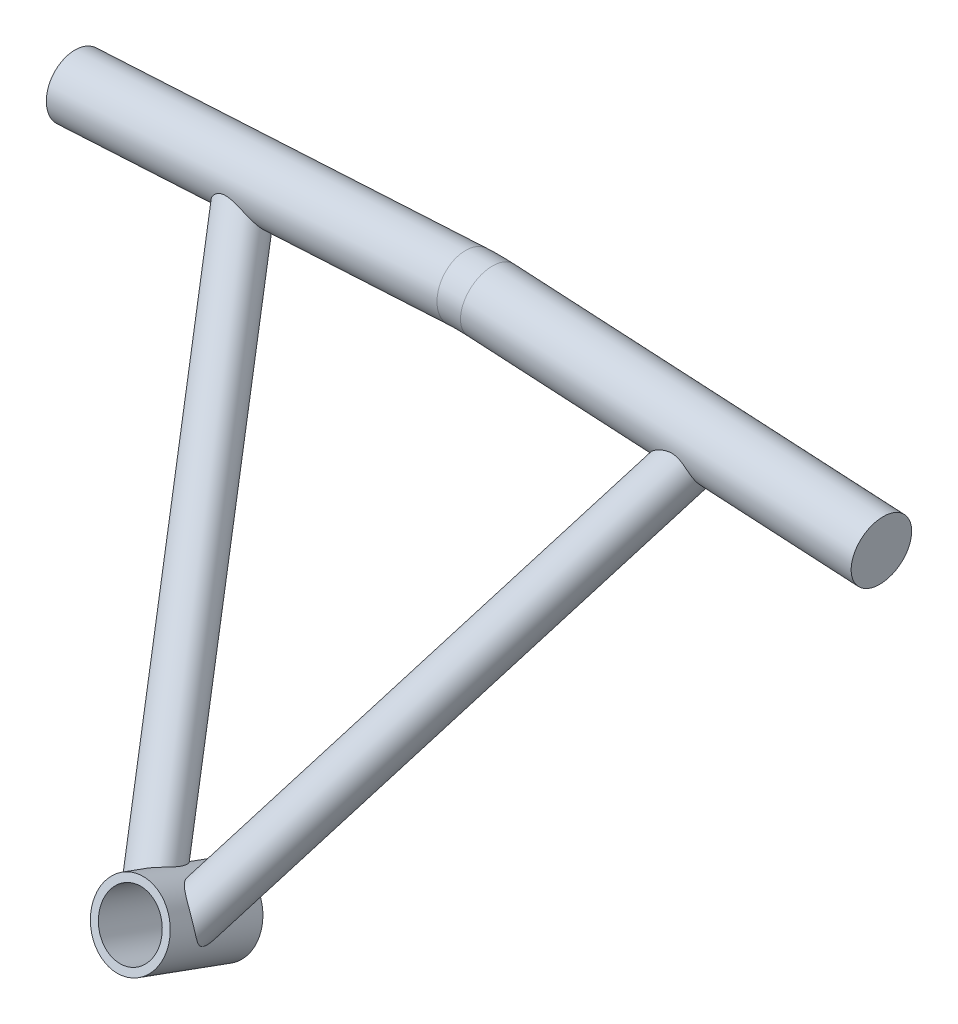
from build123d import *

# Parameters (mm, degrees)
SKETCH1_R           = 15.875
BOSS_EXTRUDE1_DEPTH = 20.701
SWEEP1_PROFILE_R    = 9.525
SWEEP2_PROFILE_R    = 9.525
CUT_EXTRUDE1_REACH  = 236.767
SKETCH2_R           = 12.7
SKETCH36_R          = 7.9375
CUT_EXTRUDE2_DEPTH  = 127
SKETCH37_R          = 7.9375
CUT_EXTRUDE3_DEPTH  = 127
SWEEP3_PROFILE_R    = 12.7


with BuildPart() as part:
    # Sketch1 → Boss-Extrude1 (new, symmetric)
    with BuildSketch(Plane(origin=(0, 0, 0), x_dir=(1, 0, 0), z_dir=(0, 0.34202014332566943, 0.9396926207859081))):
        Circle(SKETCH1_R)
    extrude(amount=BOSS_EXTRUDE1_DEPTH, both=True)

    # Sweep1: sweep along a path in Sketch4
    with BuildLine(Plane(origin=(0, 3.126764616, 3.726332964), x_dir=(1, 0, 0), z_dir=(0, 0.6427876096865406, 0.7660444431189771))) as sweep1_path:
        Line((-5.08, -4.081701322), (-98.059996607, 204.754790296))
    # Sweep1 profile (on start of the path) → Sweep1 (sweep)
    with BuildSketch(Plane(origin=(-5.08, 0, 6.35), x_dir=(0, 0.6427876096865405, 0.766044443118977), z_dir=(-0.4067366430758009, 0.699816421363697, -0.587215701058084))):
        Circle(SWEEP1_PROFILE_R)
    sweep(path=sweep1_path.line)

    # Sweep2: sweep along a path in Sketch15
    with BuildLine(Plane(origin=(0, 3.126764616, 3.726332964), x_dir=(1, 0, 0), z_dir=(0, 0.6427876096865406, 0.7660444431189771))) as sweep2_path:
        Line((5.08, -4.081701322), (98.059996607, 204.754790296))
    # Sweep2 profile (on start of the path) → Sweep2 (sweep)
    with BuildSketch(Plane(origin=(5.08, 0, 6.35), x_dir=(0, 0.6427876096865406, 0.766044443118977), z_dir=(0.40673664307580104, 0.6998164213636969, -0.587215701058084))):
        Circle(SWEEP2_PROFILE_R)
    sweep(path=sweep2_path.line)

    # Sketch2 → Cut-Extrude1 (cut, up to next)
    with BuildSketch(Plane(origin=(0, -7.080158987, -19.452576943), x_dir=(-1, 0, 0), z_dir=(0, -0.34202014332566943, -0.9396926207859081)), mode=Mode.PRIVATE) as cut_extrude1_sk1:
        Circle(SKETCH2_R)
    cut_extrude1_tool1 = extrude(cut_extrude1_sk1.sketch, amount=-CUT_EXTRUDE1_REACH, mode=Mode.PRIVATE) & part.part
    add(cut_extrude1_tool1.solids().sort_by_distance((0, -7.080159, -19.452577))[0], mode=Mode.SUBTRACT)

    # Sketch36 → Cut-Extrude2 (cut)
    with BuildSketch(Plane(origin=(-92.303757259, 158.814520853, -133.261205873), x_dir=(0.9135454576426006, 0.31157834524108413, -0.2614452745746218), z_dir=(-0.40673664307580104, 0.699816421363697, -0.5872157010580841))):
        with Locations((-6.300988418, -4.864382214)):
            Circle(SKETCH36_R)
    extrude(amount=-CUT_EXTRUDE2_DEPTH, mode=Mode.SUBTRACT)

    # Sketch37 → Cut-Extrude3 (cut)
    with BuildSketch(Plane(origin=(92.303757259, 158.814520853, -133.261205873), x_dir=(0.9135454576426006, -0.3115783452410842, 0.2614452745746218), z_dir=(0.40673664307580104, 0.6998164213636969, -0.587215701058084))):
        with Locations((6.300988418, -4.864382214)):
            Circle(SKETCH37_R)
    extrude(amount=-CUT_EXTRUDE3_DEPTH, mode=Mode.SUBTRACT)

    # Sweep3: sweep along a path in Sketch40
    with BuildLine(Plane(origin=(-106.934, 0, -127), x_dir=(1, 0, 0), z_dir=(0, 0, 1))) as sweep3_path:
        Line((-62.089448271, 154.562042412), (101.994706052, 163.692680082))
        ThreePointArc((101.994706052, 163.692680082), (106.934, 163.83), (111.873293948, 163.692680082))
        Line((111.873293948, 163.692680082), (275.957448271, 154.562042412))
    # Sweep3 profile (on start of the path) → Sweep3 (sweep)
    with BuildSketch(Plane(origin=(-169.023448271, 154.562042412, -127), x_dir=(-0.0555601119023539, 0.9984553440016224, 0), z_dir=(0.9984553440016224, 0.0555601119023539, 0))):
        Circle(SWEEP3_PROFILE_R)
    sweep(path=sweep3_path.line)


solid = part.part
